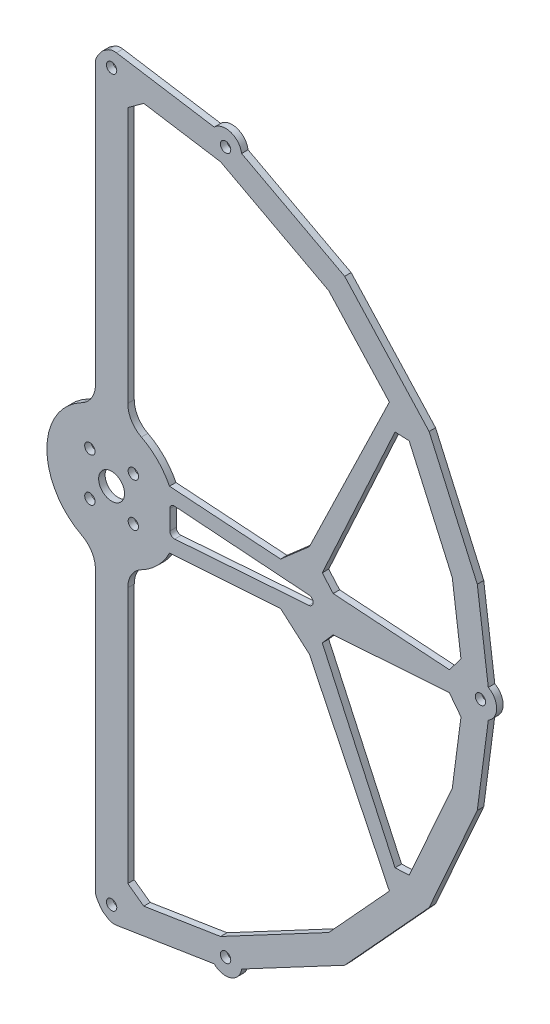
from build123d import *

# Parameters (mm, degrees)
EXTRUDE_180_DEPTH      = 8
EXTRUDE_START          = 8
SKETCH_2_W             = 6
SKETCH_2_H             = 4
EXTRUDE_456_DEPTH      = 36
EXTRUDE_START_2        = 44
EXTRUDE_180_2_DEPTH    = 3
SKETCH_4_R             = 20
SKETCH_4_R_2           = 4
EXTRUDE_691_DEPTH      = 3
EXTRUDE_744_DEPTH      = 3
SKETCH_6_W             = 10
SKETCH_6_H             = 96
EXTRUDE_1_DEPTH        = 3
EXTRUDE_Y_1_DEPTH      = 3
SKETCH_8_W             = 10
SKETCH_8_H             = 96
EXTRUDE_1_2_DEPTH      = 3
EXTRUDE_Y_1_2_DEPTH    = 3
CUT_EXTRUDE_START      = 44
CUT_EXTRUDE_1136_DEPTH = 3
EXTRUDE_1227_DEPTH     = 3
SKETCH_12_R            = 5
EXTRUDE_1296_DEPTH     = 8
SKETCH_13_R            = 1.6
CUT_EXTRUDE_1367_DEPTH = 3
SKETCH_14_R            = 1.6
CUT_EXTRUDE_1428_DEPTH = 8
SKETCH_15_W            = 600
SKETCH_15_H            = 600
CUT_EXTRUDE_1488_DEPTH = 44
F_2MM_START            = 44
F_2MM_DEPTH            = 3
SKETCH_17_R            = 5
EXTRUDE_M3_DEPTH       = 3
SKETCH_18_R            = 5
EXTRUDE_3_DEPTH        = 3
SKETCH_19_R            = 5
EXTRUDE_4_DEPTH        = 3
SKETCH_20_R            = 1.6
CUT_EXTRUDE_M3_DEPTH   = 3
R7P8_75_R              = 7.8
R3P9_R                 = 3.9
F_2MM_45_47_START      = 44
SKETCH_21_W            = 600
SKETCH_21_H            = 600
F_2MM_45_47_DEPTH      = 1
FILLET_1_R             = 1.4
CHAMFER_1_SIZE         = 5
CHAMFER_1_SIZE_2       = 4.246045496
CHAMFER_1_SIZE_3       = 3.817956769
CHAMFER_1_SIZE_4       = 4.370160244
CHAMFER_1_SIZE_5       = 3.876090347
CHAMFER_1_SIZE_6       = 9.033398393


with BuildPart() as part:
    # 草图1 → Extrude 180 (new body)
    with BuildSketch(Plane.XY):
        Polygon((0, -115), (35.536954353, -109.371499374), (70.801069662, -90.621236665), (96.447115314, -62.633489027), (111.081470023, -29.764190187), (115, 0), (111.081470023, 29.764190187), (96.447115314, 62.633489027), (70.801069662, 90.621236665), (35.536954353, 109.371499374), (0, 115), (0, 111), (34.300886376, 105.567273309), (68.338423761, 87.46919365), (93.092433042, 60.454932887), (107.217766718, 28.728914006), (111, 0), (107.217766718, -28.728914006), (93.092433042, -60.454932887), (68.338423761, -87.46919365), (34.300886376, -105.567273309), (0, -111), align=None)
    extrude(amount=EXTRUDE_180_DEPTH)

    # 草图2 → Extrude 456 (add)
    with BuildSketch(Plane.XY.offset(EXTRUDE_START)):
        Polygon((35.584965419, -103.047126287), (37.439067386, -108.753465385), (33.634841321, -109.989533363), (31.780739354, -104.283194265), align=None)
        with Locations((112, 0)):
            Rectangle(SKETCH_2_W, SKETCH_2_H)
        Polygon((31.780739354, 104.283194265), (33.634841321, 109.989533363), (37.439067386, 108.753465385), (35.584965419, 103.047126287), align=None)
    extrude(amount=EXTRUDE_456_DEPTH)

    # 草图3 → Extrude 180 2 (add)
    with BuildSketch(Plane.XY.offset(EXTRUDE_START_2)):
        Polygon((0, -115), (35.536954353, -109.371499374), (70.801069662, -90.621236665), (96.447115314, -62.633489027), (111.081470023, -29.764190187), (115, 0), (111.081470023, 29.764190187), (96.447115314, 62.633489027), (70.801069662, 90.621236665), (35.536954353, 109.371499374), (0, 115), (0, 109), (33.682852387, 103.665160276), (67.10710081, 85.893172143), (91.415091906, 59.365654817), (105.285915066, 28.211275916), (109, 0), (105.285915066, -28.211275916), (91.415091906, -59.365654817), (67.10710081, -85.893172143), (33.682852387, -103.665160276), (0, -109), align=None)
    extrude(amount=EXTRUDE_180_2_DEPTH)



with BuildPart() as body_2:
    # 草图4 → Extrude 691 (new body)
    with BuildSketch(Plane.XY.offset(EXTRUDE_START_2)):
        Circle(SKETCH_4_R)
        Circle(SKETCH_4_R_2, mode=Mode.SUBTRACT)
    extrude(amount=EXTRUDE_691_DEPTH)


with BuildPart() as part_1:
    add(part.part)

    add(body_2.part)  # Extrude 744 merges body 2
    # 草图5 → Extrude 744 (add)
    with BuildSketch(Plane.XY.offset(EXTRUDE_START_2)):
        Polygon((17, -9), (113, -2.5), (113, 2.5), (17, 9), align=None)
    extrude(amount=EXTRUDE_744_DEPTH)

    # 草图6 → Extrude 1 (add)
    with BuildSketch(Plane.XY.offset(EXTRUDE_START_2)):
        with Locations((0, -64)):
            Rectangle(SKETCH_6_W, SKETCH_6_H)
    extrude(amount=EXTRUDE_1_DEPTH)

    # 草图7 → Extrude Y__-1 (add)
    with BuildSketch(Plane.XY.offset(EXTRUDE_START_2)):
        Polygon((60.213265383, 1.279918343), (91.234949037, -66.240061243), (87.165050963, -68.159938757), (54.786734617, -1.279918343), align=None)
    extrude(amount=EXTRUDE_Y_1_DEPTH)

    # 草图8 → Extrude 1 2 (add)
    with BuildSketch(Plane.XY.offset(EXTRUDE_START_2)):
        with Locations((0, 64)):
            Rectangle(SKETCH_8_W, SKETCH_8_H)
    extrude(amount=EXTRUDE_1_2_DEPTH)

    # 草图9 → Extrude Y__1 2 (add)
    with BuildSketch(Plane.XY.offset(EXTRUDE_START_2)):
        Polygon((54.786734617, 1.279918343), (87.165050963, 68.159938757), (91.234949037, 66.240061243), (60.213265383, -1.279918343), align=None)
    extrude(amount=EXTRUDE_Y_1_2_DEPTH)

    # 草图10 → Cut-Extrude 1136 (cut)
    with BuildSketch(Plane.XY.offset(CUT_EXTRUDE_START)):
        Polygon((18, -4.5), (18, 4.5), (80.33, 0), align=None)
    extrude(amount=CUT_EXTRUDE_1136_DEPTH, mode=Mode.SUBTRACT)

    # 草图11 → Extrude 1227 (add)
    with BuildSketch(Plane.XY.offset(EXTRUDE_START_2)):
        Polygon((-5, -107), (5, -107), (5, -116.208077798), (0, -117), (-3, -115), (-5, -112), align=None)
        Polygon((-5, 107), (5, 107), (5, 116.208077798), (0, 117), (-3, 115), (-5, 112), align=None)
    extrude(amount=EXTRUDE_1227_DEPTH)

    # 草图12 → Extrude 1296 (add)
    with BuildSketch(Plane.XY):
        with Locations((0, 112)):
            Circle(SKETCH_12_R)
        with Locations((0, -112)):
            Circle(SKETCH_12_R)
    extrude(amount=EXTRUDE_1296_DEPTH)

    # 草图13 → Cut-Extrude 1367 (cut)
    with BuildSketch(Plane.XY.offset(CUT_EXTRUDE_START)):
        with Locations((0, 112)):
            Circle(SKETCH_13_R)
        with Locations((0, -112)):
            Circle(SKETCH_13_R)
        with Locations((-6.717514421, -6.717514421)):
            Circle(SKETCH_13_R)
        with Locations((-6.717514421, 6.717514421)):
            Circle(SKETCH_13_R)
        with Locations((6.717514421, -6.717514421)):
            Circle(SKETCH_13_R)
        with Locations((6.717514421, 6.717514421)):
            Circle(SKETCH_13_R)
    extrude(amount=CUT_EXTRUDE_1367_DEPTH, mode=Mode.SUBTRACT)

    # 草图14 → Cut-Extrude 1428 (cut)
    with BuildSketch(Plane.XY):
        with Locations((0, 112)):
            Circle(SKETCH_14_R)
        with Locations((0, -112)):
            Circle(SKETCH_14_R)
    extrude(amount=CUT_EXTRUDE_1428_DEPTH, mode=Mode.SUBTRACT)

    # 草图15 → Cut-Extrude 1488 (cut)
    with BuildSketch(Plane.XY):
        Rectangle(SKETCH_15_W, SKETCH_15_H)
    extrude(amount=CUT_EXTRUDE_1488_DEPTH, mode=Mode.SUBTRACT)

    # 草图16 → 外圈径向加厚2mm (add)
    with BuildSketch(Plane.XY.offset(F_2MM_START)):
        Polygon((0, -117), (36.154988342, -111.273612407), (72.032392613, -92.197258172), (98.12445645, -63.722767097), (113.013321676, -30.281828277), (117, 0), (113.013321676, 30.281828277), (98.12445645, 63.722767097), (72.032392613, 92.197258172), (36.154988342, 111.273612407), (0, 117), (0, 114), (35.227937359, 108.420442858), (70.185408187, 89.833225911), (95.608444746, 62.088849992), (110.115544197, 29.505371142), (114, 0), (110.115544197, -29.505371142), (95.608444746, -62.088849992), (70.185408187, -89.833225911), (35.227937359, -108.420442858), (0, -114), align=None)
    extrude(amount=F_2MM_DEPTH)

    # 草图17 → M3铝柱上定位耳 (add)
    with BuildSketch(Plane.XY.offset(EXTRUDE_START_2)):
        with Locations((35.227937359, -108.420442858)):
            Circle(SKETCH_17_R)
    extrude(amount=EXTRUDE_M3_DEPTH)

    # 草图18 → 凸台-拉伸3 (add)
    with BuildSketch(Plane.XY.offset(EXTRUDE_START_2)):
        with Locations((114, 0)):
            Circle(SKETCH_18_R)
    extrude(amount=EXTRUDE_3_DEPTH)

    # 草图19 → 凸台-拉伸4 (add)
    with BuildSketch(Plane.XY.offset(EXTRUDE_START_2)):
        with Locations((35.227937359, 108.420442858)):
            Circle(SKETCH_19_R)
    extrude(amount=EXTRUDE_4_DEPTH)

    # 草图20 → 三处M3上层固定孔 (cut)
    with BuildSketch(Plane.XY.offset(CUT_EXTRUDE_START)):
        with Locations((35.227937359, -108.420442858)):
            Circle(SKETCH_20_R)
        with Locations((114, 0)):
            Circle(SKETCH_20_R)
        with Locations((35.227937359, 108.420442858)):
            Circle(SKETCH_20_R)
    extrude(amount=CUT_EXTRUDE_M3_DEPTH, mode=Mode.SUBTRACT)

    # 外侧梁根部圆角_R7p8_参考75度桨保
    r7p8_75_edges = [part_1.edges().sort_by_distance(p)[0] for p in [
        (5, -19.364916731, 45.5),
        (-5, -19.364916731, 45.5),
        (-5, 19.364916731, 45.5),
        (5, 19.364916731, 45.5),
    ]]
    fillet(r7p8_75_edges, radius=R7P8_75_R)

    # 端耳外缘圆角_R3p9_轮廓内收
    r3p9_edges = [part_1.edges().sort_by_distance(p)[0] for p in [
        (-5, -112, 45.5),
        (-5, 112, 45.5),
        (-3, -115, 45.5),
        (0, -117, 45.5),
        (0, 117, 45.5),
        (-3, 115, 45.5),
    ]]
    fillet(r3p9_edges, radius=R3P9_R)

    # 草图21 → 统一2mm板厚_上层保留45至47 (cut)
    with BuildSketch(Plane.XY.offset(F_2MM_45_47_START)):
        Rectangle(SKETCH_21_W, SKETCH_21_H)
    extrude(amount=F_2MM_45_47_DEPTH, mode=Mode.SUBTRACT)

    # 圆角1
    fillet_1_edges = [part_1.edges().sort_by_distance(p)[0] for p in [
        (18, -4.5, 46),
        (80.33, 0, 46),
        (18, 4.5, 46),
    ]]
    fillet(fillet_1_edges, radius=FILLET_1_R)

    # 倒角1
    # the kernel refuses this chamfer: 9.033398393, 5, 4.370160244, 4.246045496, 3.876090347, 3.817956769 mm, written as the material it adds along each edge
    with BuildSketch(Plane(origin=(108.631931923, -2.795754609, 45), x_dir=(-0.10321619689960815, -0.9946589449140752, 0), z_dir=(0, 0, 1))) as chamfer_1_piece_1:
        Polygon((CHAMFER_1_SIZE * 0.999621916911, -CHAMFER_1_SIZE * 0.0274958766106), (CHAMFER_1_SIZE_2 * 0.17017326961, -CHAMFER_1_SIZE_2 * 0.985414155772), (0, 0), align=None)
    extrude(amount=2)
    with BuildSketch(Plane(origin=(108.631931923, 2.795754609, 47), x_dir=(-0.9995678495067102, 0.02939581998398161, 0), z_dir=(0, 0, -1))) as chamfer_1_piece_2:
        Polygon((CHAMFER_1_SIZE_2 * 0.999270274205, CHAMFER_1_SIZE_2 * 0.0381958005112), (CHAMFER_1_SIZE * 0.159614119931, CHAMFER_1_SIZE * 0.987179483538), (0, 0), align=None)
    extrude(amount=2)
    with BuildSketch(Plane(origin=(89.191460159, -61.792323046, 45), x_dir=(0.6956068650639778, 0.7184226397294735, 0), z_dir=(0, 0, 1))) as chamfer_1_piece_3:
        Polygon((CHAMFER_1_SIZE * 0.999621916911, CHAMFER_1_SIZE * 0.0274958766106), (CHAMFER_1_SIZE_3 * 0.36240953925, CHAMFER_1_SIZE_3 * 0.932018951466), (0, 0), align=None)
    extrude(amount=2)
    with BuildSketch(Plane(origin=(89.191460159, 61.792323046, 47), x_dir=(-0.4601932489228402, -0.8878187729744403, 0), z_dir=(0, 0, -1))) as chamfer_1_piece_4:
        Polygon((CHAMFER_1_SIZE_3 * 0.998870534427, -CHAMFER_1_SIZE_3 * 0.0475147922669), (CHAMFER_1_SIZE * 0.343666607926, -CHAMFER_1_SIZE * 0.939091722143), (0, 0), align=None)
    extrude(amount=2)
    with BuildSketch(Plane(origin=(5, -108.208077798, 47), x_dir=(-0.03603131014618112, 0.9993506615243469, 0), z_dir=(0, 0, -1)), Plane(origin=(5, 108.208077798, 45), x_dir=(-0.0360313101461817, -0.9993506615243467, 0), z_dir=(0, 0, 1))) as chamfer_1_piece_5:
        Polygon((CHAMFER_1_SIZE_4 * 0.999350661636, CHAMFER_1_SIZE_4 * 0.0360313101502), (CHAMFER_1_SIZE * 0.120745181195, CHAMFER_1_SIZE * 0.992683535281), (0, 0), align=None)
    extrude(amount=2)
    with BuildSketch(Plane(origin=(63.490093255, 5.852233269, 45), x_dir=(0.37520935392057214, 0.9269400955458269, 0), z_dir=(0, 0, 1)), Plane(origin=(63.490093255, -5.852233269, 47), x_dir=(0.37520935392056365, -0.9269400955458303, 0), z_dir=(0, 0, -1))) as chamfer_1_piece_6:
        Polygon((CHAMFER_1_SIZE_5 * 0.998939538699, -CHAMFER_1_SIZE_5 * 0.0460412632699), (CHAMFER_1_SIZE * 0.311734042399, -CHAMFER_1_SIZE * 0.950169399007), (0, 0), align=None)
    extrude(amount=2)
    with BuildSketch(Plane(origin=(57.2062873, -6.277699297, 45), x_dir=(-0.9998189901573707, -0.0190259538708392, 0), z_dir=(0, 0, 1)), Plane(origin=(57.2062873, 6.277699297, 47), x_dir=(-0.9998189901573707, 0.019025953870838982, 0), z_dir=(0, 0, -1))) as chamfer_1_piece_7:
        Polygon((CHAMFER_1_SIZE * 0.998820318674, CHAMFER_1_SIZE * 0.0485589436086), (-CHAMFER_1_SIZE_6 * 0.418542922597, CHAMFER_1_SIZE_6 * 0.908197017112), (0, 0), align=None)
    extrude(amount=2)


solid = part_1.part
